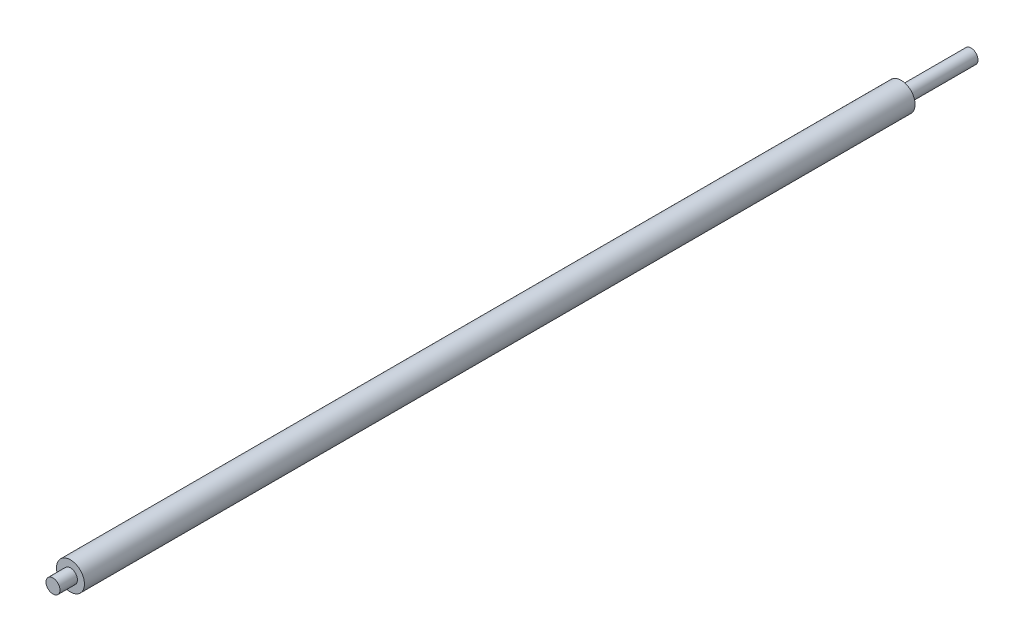
from build123d import *

# Parameters (mm, degrees)
SKETCH1_R           = 6
BOSS_EXTRUDE1_DEPTH = 178.25
SKETCH2_R           = 3
BOSS_EXTRUDE2_DEPTH = 7.5
BOSS_EXTRUDE3_START = 30
SKETCH3_R           = 3
BOSS_EXTRUDE3_DEPTH = 30


with BuildPart() as part:
    # Sketch1 → Boss-Extrude1 (new, symmetric)
    with BuildSketch(Plane.XY):
        Circle(SKETCH1_R)
    extrude(amount=BOSS_EXTRUDE1_DEPTH, both=True)

    # Sketch2 → Boss-Extrude2 (add)
    with BuildSketch(Plane.XY.offset(178.25)):
        Circle(SKETCH2_R)
    extrude(amount=BOSS_EXTRUDE2_DEPTH)

    # Sketch3 → Boss-Extrude3 (add)
    with BuildSketch(Plane(origin=(0, 0, -178.25), x_dir=(-1, 0, 0), z_dir=(0, 0, -1)).offset(BOSS_EXTRUDE3_START)):
        Circle(SKETCH3_R)
    extrude(amount=-BOSS_EXTRUDE3_DEPTH)


solid = part.part
